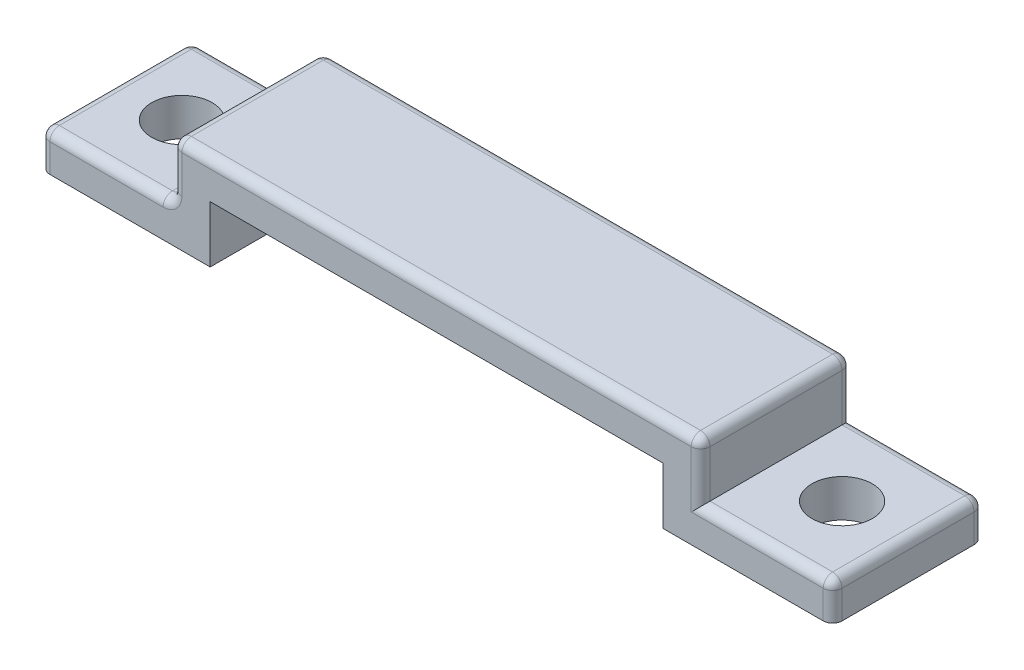
from build123d import *

# Parameters (mm, degrees)
GRUNDK_RPER_DEPTH         = 8
SKIZZE2_R                 = 1.6
BOHRUNG_BEFESTIGUNG_DEPTH = 23.671568098
VERRUNDUNG1_R             = 0.5


with BuildPart() as part:
    # Skizze1 → Grundkörper (new body)
    with BuildSketch(Plane.XY):
        Polygon((-21, 0), (-12, 0), (-12, 3), (12, 3), (12, 0), (21, 0), (21, 2), (14, 2), (14, 5), (-14, 5), (-14, 2), (-21, 2), align=None)
    extrude(amount=GRUNDK_RPER_DEPTH)

    # Skizze2 → Bohrung_Befestigung (cut, through all)
    with BuildSketch(Plane(origin=(0, 2, 0), x_dir=(1, 0, 0), z_dir=(0, 1, 0))):
        with Locations((-17.5, -4)):
            Circle(SKIZZE2_R)
        with Locations((17.5, -4)):
            Circle(SKIZZE2_R)
    extrude(amount=-BOHRUNG_BEFESTIGUNG_DEPTH, mode=Mode.SUBTRACT)

    # Verrundung1
    verrundung1_edges = [part.edges().sort_by_distance(p)[0] for p in [
        (-14, 3.5, 8),
        (-14, 3.5, 0),
        (-21, 1, 0),
        (-21, 1, 8),
        (21, 1, 8),
        (21, 1, 0),
        (21, 2, 4),
        (17.5, 2, 0),
        (17.5, 2, 8),
        (14, 3.5, 8),
        (14, 3.5, 0),
        (14, 5, 4),
        (0, 5, 0),
        (0, 5, 8),
        (-14, 5, 4),
        (-14, 2, 4),
        (-17.5, 2, 8),
        (-21, 2, 4),
        (-17.5, 2, 0),
    ]]
    fillet(verrundung1_edges, radius=VERRUNDUNG1_R)


solid = part.part
